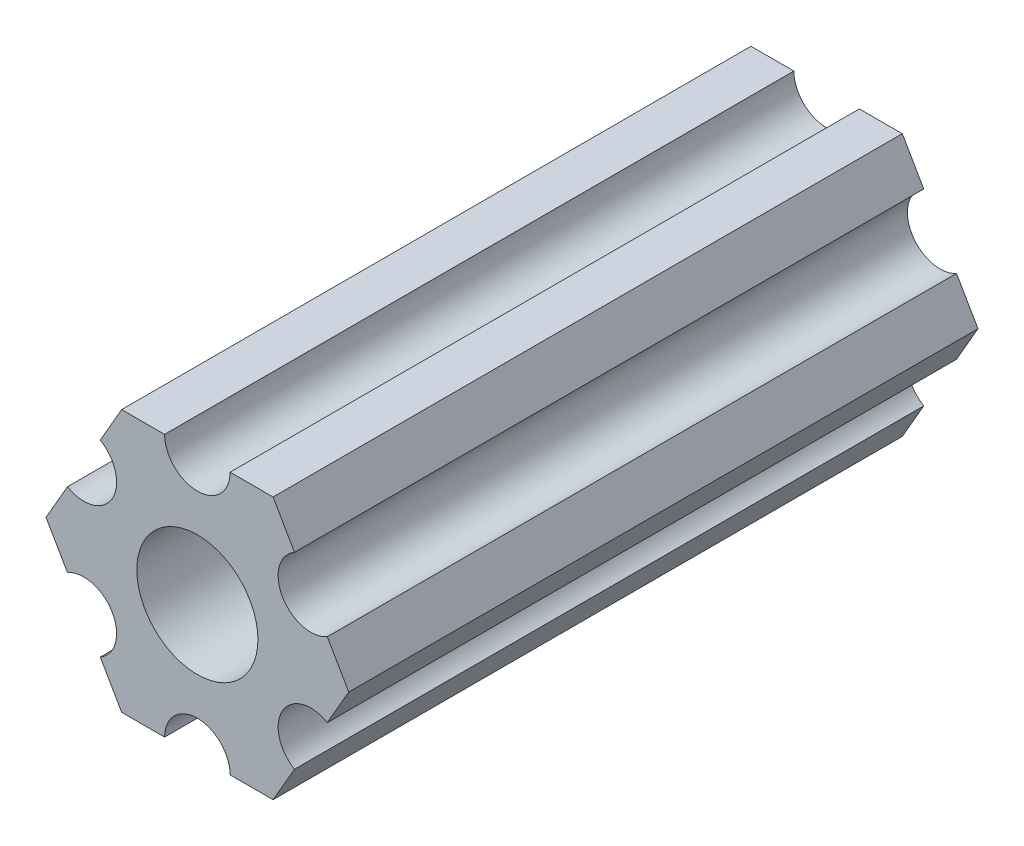
from build123d import *

# Parameters (mm, degrees)
SKETCH1_R           = 2.9337
BOSS_EXTRUDE1_DEPTH = 30.48


with BuildPart() as part:
    # Sketch1 → Boss-Extrude1 (new body)
    with BuildSketch(Plane.XY):
        with BuildLine():
            Line((-4.70551159, -4.549815043), (-3.666174521, -6.349999904))
            Line((-3.666174521, -6.349999904), (-1.587501154, -6.349999904))
            ThreePointArc((-1.587501154, -6.349999904), (-3.85e-07, -4.762499134), (1.587501154, -6.349999904))
            Line((1.587501154, -6.349999904), (3.666173825, -6.349999904))
            Line((3.666173825, -6.349999904), (4.705510929, -4.549815232))
            ThreePointArc((4.705510929, -4.549815232), (4.124445601, -2.381249904), (6.293010929, -1.800184575))
            Line((6.293010929, -1.800184575), (7.332348034, 9.6e-08))
            Line((7.332348034, 9.6e-08), (6.293011178, 1.800184715))
            ThreePointArc((6.293011178, 1.800184715), (4.124445902, 2.381250241), (4.705511428, 4.549815516))
            Line((4.705511428, 4.549815516), (3.666174521, 6.350000222))
            Line((3.666174521, 6.350000222), (1.587498846, 6.350000222))
            ThreePointArc((1.587498846, 6.350000222), (3.85e-07, 4.762501761), (-1.587498846, 6.350000222))
            Line((-1.587498846, 6.350000222), (-3.666173825, 6.350000222))
            Line((-3.666173825, 6.350000222), (-4.705511038, 4.549815614))
            ThreePointArc((-4.705511038, 4.549815614), (-4.124445841, 2.38125025), (-6.293011205, 1.800185053))
            Line((-6.293011205, 1.800185053), (-7.332348419, 4.44e-07))
            Line((-7.332348419, 4.44e-07), (-6.293011423, -1.80018429))
            ThreePointArc((-6.293011423, -1.80018429), (-4.12444613, -2.38124975), (-4.70551159, -4.549815043))
        make_face()
        Circle(SKETCH1_R, mode=Mode.SUBTRACT)
    extrude(amount=-BOSS_EXTRUDE1_DEPTH)


solid = part.part
